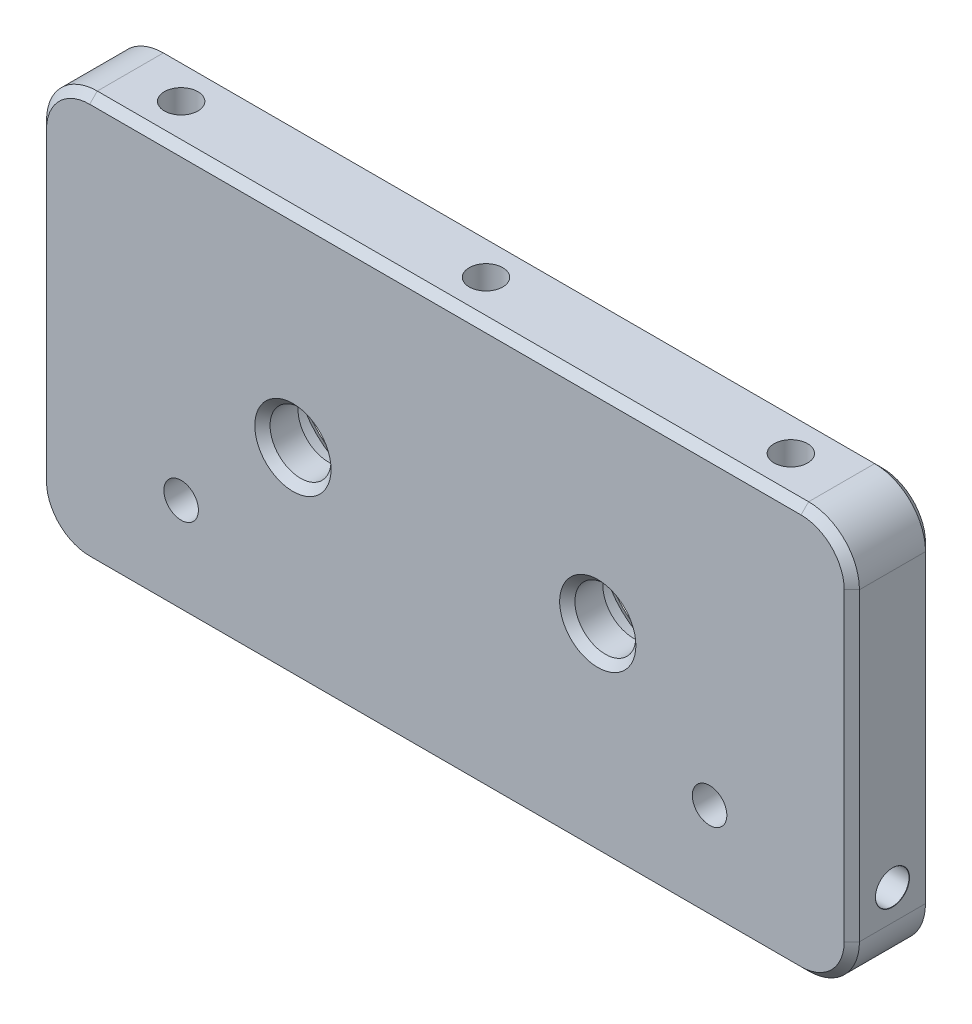
from build123d import *

# Parameters (mm, degrees)
SKETCH1_W                       = 80
SKETCH1_H                       = 40
SKETCH1_R                       = 7
SKETCH1_R_2                     = 3
BOSS_EXTRUDE1_DEPTH             = 8
CUT_EXTRUDE1_OUTLINE_R          = 7
CUT_EXTRUDE1_OUTLINE_R_2        = 3
CUT_EXTRUDE1_DEPTH              = 4.5
FILLET1_R                       = 5
CBORE_FOR_M3_SHCS1_AT_2_COUNT   = 2
CBORE_FOR_M3_SHCS1_AT_2_PITCH   = 52
M4X0_7_TAPPED_HOLE4_D           = 3.3
M4X0_7_TAPPED_HOLE4_DEPTH       = 40
M4X0_7_TAPPED_HOLE4_CSINK_D     = 4.05
M4X0_7_TAPPED_HOLE4_CSINK_ANGLE = 90
M4X0_7_TAPPED_HOLE4_TIP         = 0.991420021
CHAMFER1_SIZE                   = 0.75


# Read off the part's stored shape, not the designer's step: Cut-Extrude1
with BuildPart() as part:
    # Sketch1 → Boss-Extrude1 (new body)
    # profile 1 of 3: a face of its own
    with BuildSketch(Plane.XY):
        Rectangle(SKETCH1_W, SKETCH1_H)
        with Locations((15, 0)):
            Circle(SKETCH1_R, mode=Mode.SUBTRACT)
        with Locations((-15, 0)):
            Circle(SKETCH1_R, mode=Mode.SUBTRACT)
    # profile 2 of 3: a face of its own
    with BuildSketch(Plane.XY):
        with Locations((15, 0)):
            Circle(SKETCH1_R)
        with Locations((15, 0)):
            Circle(SKETCH1_R_2, mode=Mode.SUBTRACT)
    # profile 3 of 3: a face of its own
    with BuildSketch(Plane.XY):
        with Locations((-15, 0)):
            Circle(SKETCH1_R)
        with Locations((-15, 0)):
            Circle(SKETCH1_R_2, mode=Mode.SUBTRACT)
    extrude(amount=BOSS_EXTRUDE1_DEPTH)

    # Cut-Extrude1 outline → Cut-Extrude1 (cut)
    # profile 1 of 2: a face of its own
    with BuildSketch(Plane.XY):
        with Locations((15, 0)):
            Circle(CUT_EXTRUDE1_OUTLINE_R)
        with Locations((15, 0)):
            Circle(CUT_EXTRUDE1_OUTLINE_R_2, mode=Mode.SUBTRACT)
    # profile 2 of 2: a face of its own
    with BuildSketch(Plane.XY):
        with Locations((-15, 0)):
            Circle(CUT_EXTRUDE1_OUTLINE_R)
        with Locations((-15, 0)):
            Circle(CUT_EXTRUDE1_OUTLINE_R_2, mode=Mode.SUBTRACT)
    extrude(amount=CUT_EXTRUDE1_DEPTH, mode=Mode.SUBTRACT)

    # Fillet1
    fillet1_edges = [part.edges().sort_by_distance(p)[0] for p in [
        (40, -20, 4),
        (-40, -20, 4),
        (-40, 20, 4),
        (40, 20, 4),
    ]]
    fillet(fillet1_edges, radius=FILLET1_R)

    # Sketch2 → CBORE for M3 SHCS1 (revolve, cut)
    with BuildSketch(Plane(origin=(26, -10, 0), x_dir=(0, 1, 0), z_dir=(1, 0, 0))):
        Polygon((0, 0), (0, 8), (1.7, 8), (1.7, 3), (3.25, 3), (3.25, 0.025), (3.275, 0), align=None)
    cbore_for_m3_shcs1 = revolve(axis=Axis((26, -10, -6.35), (0, 0, 1)), mode=Mode.SUBTRACT)

    # CBORE for M3 SHCS1 at 2: CBORE for M3 SHCS1 ×2
    with Locations(*[(-i * CBORE_FOR_M3_SHCS1_AT_2_PITCH, 0, 0) for i in range(1, CBORE_FOR_M3_SHCS1_AT_2_COUNT)]):
        add(cbore_for_m3_shcs1, mode=Mode.SUBTRACT)

    # M4x0.7 Tapped Hole4
    with Locations(Plane(origin=(0, -20, 0), x_dir=(-1, 0, 0), z_dir=(0, -1, 0))):
        with Locations((0, -4), (30, -4), (-30, -4)):
            CounterSinkHole(M4X0_7_TAPPED_HOLE4_D / 2, M4X0_7_TAPPED_HOLE4_CSINK_D / 2, depth=M4X0_7_TAPPED_HOLE4_DEPTH, counter_sink_angle=M4X0_7_TAPPED_HOLE4_CSINK_ANGLE)
            with Locations((0, 0, -(M4X0_7_TAPPED_HOLE4_DEPTH + M4X0_7_TAPPED_HOLE4_TIP / 2))):  # 118° drill point
                Cone(0, M4X0_7_TAPPED_HOLE4_D / 2, M4X0_7_TAPPED_HOLE4_TIP, mode=Mode.SUBTRACT)

    # Sketch8 → Tap Drill for M4x0.7 Tap1 (revolve, cut)
    with BuildSketch(Plane(origin=(-40, -12, 4), x_dir=(0, 0, 1), z_dir=(0, 1, 0))):
        Polygon((0, 0), (0, 12.991420021), (1.65, 12), (1.65, 0.025), (1.675, 0), align=None)
    tap_drill_for_m4x0_7_tap1 = revolve(axis=Axis((-46.35, -12, 4), (1, 0, 0)), mode=Mode.SUBTRACT)

    # Mirror1: Tap Drill for M4x0.7 Tap1 across plane
    add(tap_drill_for_m4x0_7_tap1.mirror(Plane(origin=(0, 0, 0), x_dir=(0, 0, 1), z_dir=(1, 0, 0))), mode=Mode.SUBTRACT)

    # Chamfer1
    chamfer1_edges = [part.edges().sort_by_distance(p)[0] for p in [
        (-22, 0, 0),
        (-18, 0, 8),
        (8, 0, 0),
        (12, 0, 8),
        (40, 0, 0),
        (40, 0, 8),
        (0, -20, 0),
        (-40, 0, 0),
        (0, 20, 0),
        (38.535533906, 18.535533906, 0),
        (-38.535533906, 18.535533906, 0),
        (-38.535533906, -18.535533906, 0),
        (38.535533906, -18.535533906, 0),
        (0, -20, 8),
        (0, 20, 8),
        (-40, 0, 8),
        (38.535533906, 18.535533906, 8),
        (-38.535533906, 18.535533906, 8),
        (-38.535533906, -18.535533906, 8),
        (38.535533906, -18.535533906, 8),
    ]]
    chamfer(chamfer1_edges, length=CHAMFER1_SIZE)


solid = part.part
